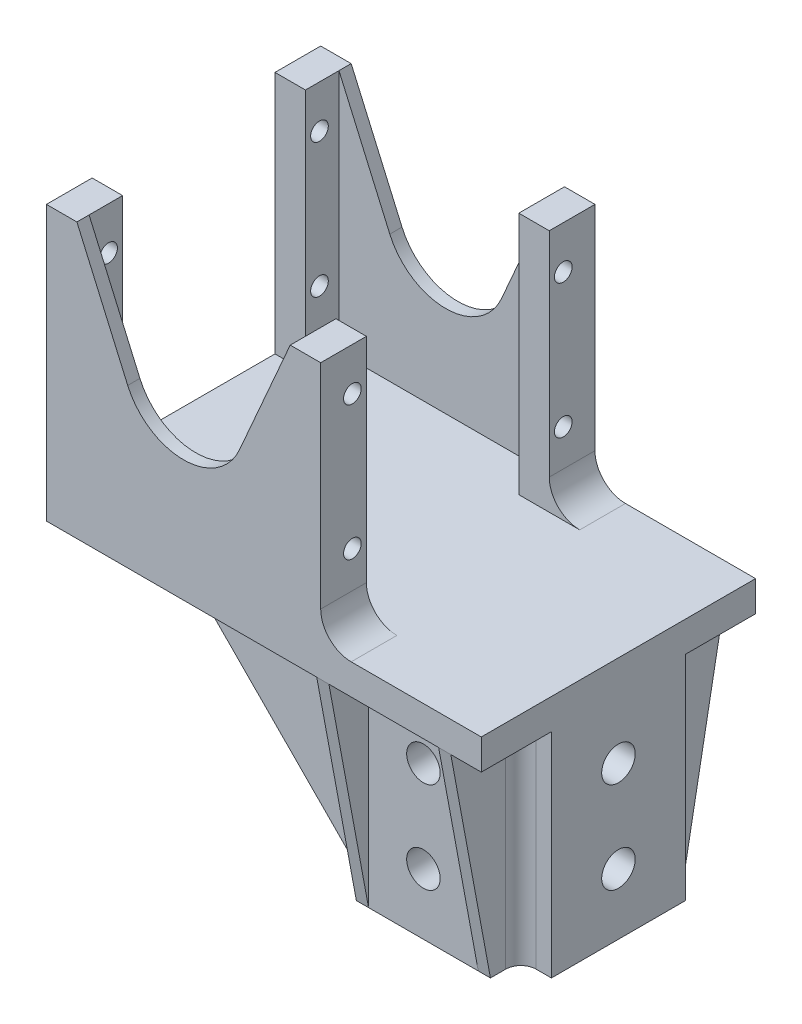
from build123d import *

# Parameters (mm, degrees)
BOSS_EXTRUDE1_DEPTH           = 45
SKETCH3_W                     = 30
SKETCH3_H                     = 40
CUT_EXTRUDE1_DEPTH            = 88.304481557
SKETCH4_W                     = 32
SKETCH4_H                     = 32
SKETCH4_W_2                   = 20.5
SKETCH4_H_2                   = 20.5
BOSS_EXTRUDE2_DEPTH           = 35
SKETCH6_W                     = 5
SKETCH6_H                     = 5
CUT_EXTRUDE4_DEPTH            = 35
RIB1_REACH                    = 87.394
SKETCH9_WALL_W                = 221.994100462
SKETCH9_WALL_H                = 2
LPATTERN1_COUNT               = 2
LPATTERN1_PITCH               = 20
RIB6_REACH                    = 100.659
SKETCH14_WALL_W               = 234.916193708
SKETCH14_WALL_H               = 2
RIB7_START                    = -2
RIB7_DEPTH                    = 2
FILLET2_R                     = 5
FILLET3_R                     = 5
RIB10_REACH                   = 92.525
SKETCH17_WALL_W               = 226.71130823
SKETCH17_WALL_H               = 2
RIB11_REACH                   = 92.525
SKETCH18_WALL_W               = 226.71130823
SKETCH18_WALL_H               = 2
FILLET4_R                     = 10
LPATTERN2_COUNT               = 2
LPATTERN2_PITCH               = 43
FILLET4_OF_LPATTERN2_R        = 10
M5_CLEARANCE_HOLE2_AT_2_COUNT = 2
M5_CLEARANCE_HOLE2_AT_2_PITCH = 15
M2_5_CLEARANCE_HOLE1_D        = 2.9
FILLET5_R                     = 2.5
SKETCH4_4_R                   = 2.5
BOSS_EXTRUDE4_DEPTH           = 8
CIRPATTERN1_COUNT             = 4


# Read off the part's stored shape, not the designer's step: Rib7
with BuildPart() as part:
    # Sketch2 → Boss-Extrude1 (new body)
    with BuildSketch(Plane.XY):
        Polygon((-53.5125, -22.5), (17.8375, -22.5), (17.8375, -17.5), (-8.5125, -17.5), (-8.5125, 22.5), (-13.5125, 22.5), (-13.5125, -17.5), (-48.5125, -17.5), (-48.5125, 22.5), (-53.5125, 22.5), align=None)
    extrude(amount=BOSS_EXTRUDE1_DEPTH)

    # Sketch3 → Cut-Extrude1 (cut, through all)
    with BuildSketch(Plane(origin=(-53.5125, 0, 0), x_dir=(0, 0, -1), z_dir=(1, 0, 0))):
        with Locations((-22.5, 2.5)):
            Rectangle(SKETCH3_W, SKETCH3_H)
    extrude(amount=CUT_EXTRUDE1_DEPTH, mode=Mode.SUBTRACT)

    # Sketch4 → Boss-Extrude2 (add)
    with BuildSketch(Plane.XZ.offset(22.5)):
        with Locations((1.8375, 22.5)):
            Rectangle(SKETCH4_W, SKETCH4_H)
        with Locations((1.8375, 22.5)):
            Rectangle(SKETCH4_W_2, SKETCH4_H_2, mode=Mode.SUBTRACT)
    extrude(amount=BOSS_EXTRUDE2_DEPTH)

    # Sketch6 → Cut-Extrude4 (cut)
    with BuildSketch(Plane(origin=(0, -57.5, 0), x_dir=(-1, 0, 0), z_dir=(0, -1, 0))):
        with Locations((11.6625, -36)):
            Rectangle(SKETCH6_W, SKETCH6_H)
        with Locations((-15.3375, -36)):
            Rectangle(SKETCH6_W, SKETCH6_H)
        with Locations((-15.3375, -9)):
            Rectangle(SKETCH6_W, SKETCH6_H)
        with Locations((11.6625, -9)):
            Rectangle(SKETCH6_W, SKETCH6_H)
    extrude(amount=-CUT_EXTRUDE4_DEPTH, mode=Mode.SUBTRACT)

    # Sketch9 wall → Rib1 (add, up to next)
    with BuildSketch(Plane(origin=(-31.45625, -40, 33.5), x_dir=(-0.70290285213, 0.7112858641, 0), z_dir=(-0.7112858641, -0.70290285213, 0)), mode=Mode.PRIVATE) as rib1_sk1:
        with Locations((0, 1)):
            Rectangle(SKETCH9_WALL_W, SKETCH9_WALL_H)
    rib1_tool1 = extrude(rib1_sk1.sketch, amount=-RIB1_REACH, mode=Mode.PRIVATE) - part.part
    rib1 = rib1_tool1.solids().sort_by_distance((-31.45625, -40, 33.5))[0]
    add(rib1)

    # LPattern1: Rib1 ×2
    with Locations(*[(0, 0, -i * LPATTERN1_PITCH) for i in range(1, LPATTERN1_COUNT)]):
        add(rib1)

    # Sketch14 wall → Rib6 (add, up to next)
    with BuildSketch(Plane(origin=(12.8375, -40, 3.25), x_dir=(0, 0.983188736076, -0.182592193843), z_dir=(0, 0.182592193843, 0.983188736076)), mode=Mode.PRIVATE) as rib6_sk1:
        with Locations((0, 1)):
            Rectangle(SKETCH14_WALL_W, SKETCH14_WALL_H)
    rib6_tool1 = extrude(rib6_sk1.sketch, amount=RIB6_REACH, mode=Mode.PRIVATE) - part.part
    rib6 = rib6_tool1.solids().sort_by_distance((12.8375, -40, 3.25))[0]
    add(rib6)

    # Rib7 outline → Rib7 (add)
    with BuildSketch(Plane.ZY.offset(9.1625).offset(RIB7_START)):
        Polygon((0, -22.5), (6.5, -57.5), (6.5, -22.5), align=None)
    rib7 = extrude(amount=RIB7_DEPTH)

    # Fillet2
    fillet2_edges = [part.edges().sort_by_distance(p)[0] for p in [
        (1.8375, -22.5, 38.5),
        (-14.1625, -22.5, 22.5),
        (1.8375, -22.5, 6.5),
    ]]
    fillet(fillet2_edges, radius=FILLET2_R)

    # Fillet3
    fillet3_edges = [part.edges().sort_by_distance(p)[0] for p in [
        (-8.5125, -17.5, 41.25),
        (-8.5125, -17.5, 3.75),
    ]]
    fillet(fillet3_edges, radius=FILLET3_R)

    # Sketch17 wall → Rib10 (add, up to next)
    with BuildSketch(Plane(origin=(-39.7625, 2.5, 45), x_dir=(0.40081883402, -0.916157334902, 0), z_dir=(0.916157334902, 0.40081883402, 0)), mode=Mode.PRIVATE) as rib10_sk1:
        with Locations((0, 1)):
            Rectangle(SKETCH17_WALL_W, SKETCH17_WALL_H)
    rib10_tool1 = extrude(rib10_sk1.sketch, amount=-RIB10_REACH, mode=Mode.PRIVATE) - part.part
    rib10 = rib10_tool1.solids().sort_by_distance((-39.7625, 2.5, 45))[0]
    add(rib10)

    # Sketch18 wall → Rib11 (add, up to next)
    with BuildSketch(Plane(origin=(-22.2625, 2.5, 45), x_dir=(0.40081883402, 0.916157334902, 0), z_dir=(-0.916157334902, 0.40081883402, 0)), mode=Mode.PRIVATE) as rib11_sk1:
        with Locations((0, 1)):
            Rectangle(SKETCH18_WALL_W, SKETCH18_WALL_H)
    rib11_tool1 = extrude(rib11_sk1.sketch, amount=-RIB11_REACH, mode=Mode.PRIVATE) - part.part
    rib11 = rib11_tool1.solids().sort_by_distance((-22.2625, 2.5, 45))[0]
    add(rib11)

    # Fillet4
    # the kernel refuses this fillet: 10 mm, written as the material it adds along each edge
    with BuildSketch(Plane(origin=(-31.0125, -17.5, 45), x_dir=(-0.4008188340200226, 0.9161573349020513, 0), z_dir=(0, 0, -1))) as fillet4_piece_1:
        with BuildLine():
            CenterArc((FILLET4_R * 2.28571428571, FILLET4_R), FILLET4_R, 137.258755461, 132.741244539)
            Line((FILLET4_R * 1.55128805621, FILLET4_R * 1.67868852459), (0, 0))
            Line((0, 0), (FILLET4_R * 2.28571428571, 0))
        make_face()
    extrude(amount=2)

    # LPattern2: Rib10, Rib11 ×2
    with Locations(*[(0, 0, -i * LPATTERN2_PITCH) for i in range(1, LPATTERN2_COUNT)]):
        add(rib10)
        add(rib11)

    # Fillet4 of LPattern2
    # the kernel refuses this fillet: 10 mm, written as the material it adds along each edge
    with BuildSketch(Plane(origin=(-31.0125, -17.5, 59.142857143), x_dir=(-0.4008188340200225, 0.9161573349020515, 0), z_dir=(0, 0, -1))) as fillet4_of_lpattern2_piece_1_section:
        with BuildLine():
            CenterArc((FILLET4_OF_LPATTERN2_R * 2.28571428571, FILLET4_OF_LPATTERN2_R), FILLET4_OF_LPATTERN2_R, 137.258755461, 132.741244539)
            Line((FILLET4_OF_LPATTERN2_R * 1.5512880562, FILLET4_OF_LPATTERN2_R * 1.67868852459), (0, 0))
            Line((0, 0), (FILLET4_OF_LPATTERN2_R * 2.28571428571, 0))
        make_face()
    fillet4_of_lpattern2_piece_1 = extrude(amount=59.142857143, mode=Mode.PRIVATE)
    fillet4_of_lpattern2_piece_1 = split(fillet4_of_lpattern2_piece_1, bisect_by=Plane(origin=(-31.0125, -6.732617491, 43), z_dir=(0, 0, 1)), keep=Keep.TOP, mode=Mode.PRIVATE)
    fillet4_of_lpattern2_piece_1 = split(fillet4_of_lpattern2_piece_1, bisect_by=Plane(origin=(-31.0125, -6.732617491, 45), z_dir=(0, 0, -1)), keep=Keep.TOP, mode=Mode.PRIVATE)
    add(fillet4_of_lpattern2_piece_1)
    with BuildSketch(Plane(origin=(-31.0125, -17.5, 2), x_dir=(-0.4008188340200226, 0.9161573349020513, 0), z_dir=(0, 0, -1))) as fillet4_of_lpattern2_piece_2:
        with BuildLine():
            CenterArc((FILLET4_OF_LPATTERN2_R * 2.28571428571, FILLET4_OF_LPATTERN2_R), FILLET4_OF_LPATTERN2_R, 137.258755461, 132.741244539)
            Line((FILLET4_OF_LPATTERN2_R * 1.55128805621, FILLET4_OF_LPATTERN2_R * 1.67868852459), (0, 0))
            Line((0, 0), (FILLET4_OF_LPATTERN2_R * 2.28571428571, 0))
        make_face()
    extrude(amount=2)

    # Sketch22 → M5 Clearance Hole2 (revolve, cut)
    with BuildSketch(Plane(origin=(1.8375, -32.5, 38.5), x_dir=(0, -1, 0), z_dir=(1, 0, 0))):
        Polygon((0, 0), (0, 7.652366702), (2.75, 6), (2.75, 0), align=None)
    m5_clearance_hole2 = revolve(axis=Axis((1.8375, -32.5, 44.85), (0, 0, -1)), mode=Mode.SUBTRACT)

    # M5 Clearance Hole2 at 2: M5 Clearance Hole2 ×2
    with Locations(*[(0, -i * M5_CLEARANCE_HOLE2_AT_2_PITCH, 0) for i in range(1, M5_CLEARANCE_HOLE2_AT_2_COUNT)]):
        add(m5_clearance_hole2, mode=Mode.SUBTRACT)

    # M2.5 Clearance Hole1 (through all)
    with Locations(Plane.ZY.offset(53.5125)):
        with Locations((5.2, 15.5), (39.8, 15.5), (39.8, -6.5), (5.2, -6.5)):
            Hole(M2_5_CLEARANCE_HOLE1_D / 2)

    # Fillet5
    fillet5_edges = [part.edges().sort_by_distance(p)[0] for p in [
        (-9.1625, -40, 11.5),
        (12.8375, -40, 11.5),
        (12.8375, -40, 33.5),
        (-9.1625, -40, 33.5),
    ]]
    fillet(fillet5_edges, radius=FILLET5_R)

    # Sketch4<4> → Boss-Extrude4 (add)
    with BuildSketch(Plane.XZ.offset(22.5)):
        with Locations(Location((1.8375, 22.5, 0), (0, 0, 180))):
            Circle(SKETCH4_4_R)
    extrude(amount=BOSS_EXTRUDE4_DEPTH)

    # CirPattern1: M5 Clearance Hole2 ×4 about axis
    cirpattern1_axis = Axis((1.8375, -30.5, 22.5), (0, -1, 0))
    for i in range(1, CIRPATTERN1_COUNT):
        add(m5_clearance_hole2.rotate(cirpattern1_axis, i * 360 / CIRPATTERN1_COUNT), mode=Mode.SUBTRACT)

    # CirPattern1 copy 1 sketch → CirPattern1 copy 1 (revolve, cut)
    with BuildSketch(Plane(origin=(-14.1625, -47.5, 22.5), x_dir=(0, -1, 0), z_dir=(0, 0, 1))):
        Polygon((0, 0), (0, 7.652366702), (2.75, 6), (2.75, 0), align=None)
    revolve(axis=Axis((-20.5125, -47.5, 22.5), (1, 0, 0)), mode=Mode.SUBTRACT)

    # CirPattern1 copy 2 sketch → CirPattern1 copy 2 (revolve, cut)
    with BuildSketch(Plane(origin=(1.8375, -47.5, 6.5), x_dir=(0, -1, 0), z_dir=(-1, 0, 0))):
        Polygon((0, 0), (0, 7.652366702), (2.75, 6), (2.75, 0), align=None)
    revolve(axis=Axis((1.8375, -47.5, 0.15), (0, 0, 1)), mode=Mode.SUBTRACT)

    # CirPattern1 copy 3 sketch → CirPattern1 copy 3 (revolve, cut)
    with BuildSketch(Plane(origin=(17.8375, -47.5, 22.5), x_dir=(0, -1, 0), z_dir=(0, 0, -1))):
        Polygon((0, 0), (0, 7.652366702), (2.75, 6), (2.75, 0), align=None)
    revolve(axis=Axis((24.1875, -47.5, 22.5), (-1, 0, 0)), mode=Mode.SUBTRACT)

    # Mirror1: Rib6, Rib7 across plane
    add(rib6.mirror(Plane.XY.offset(22.5)))
    add(rib7.mirror(Plane.XY.offset(22.5)))


solid = part.part
